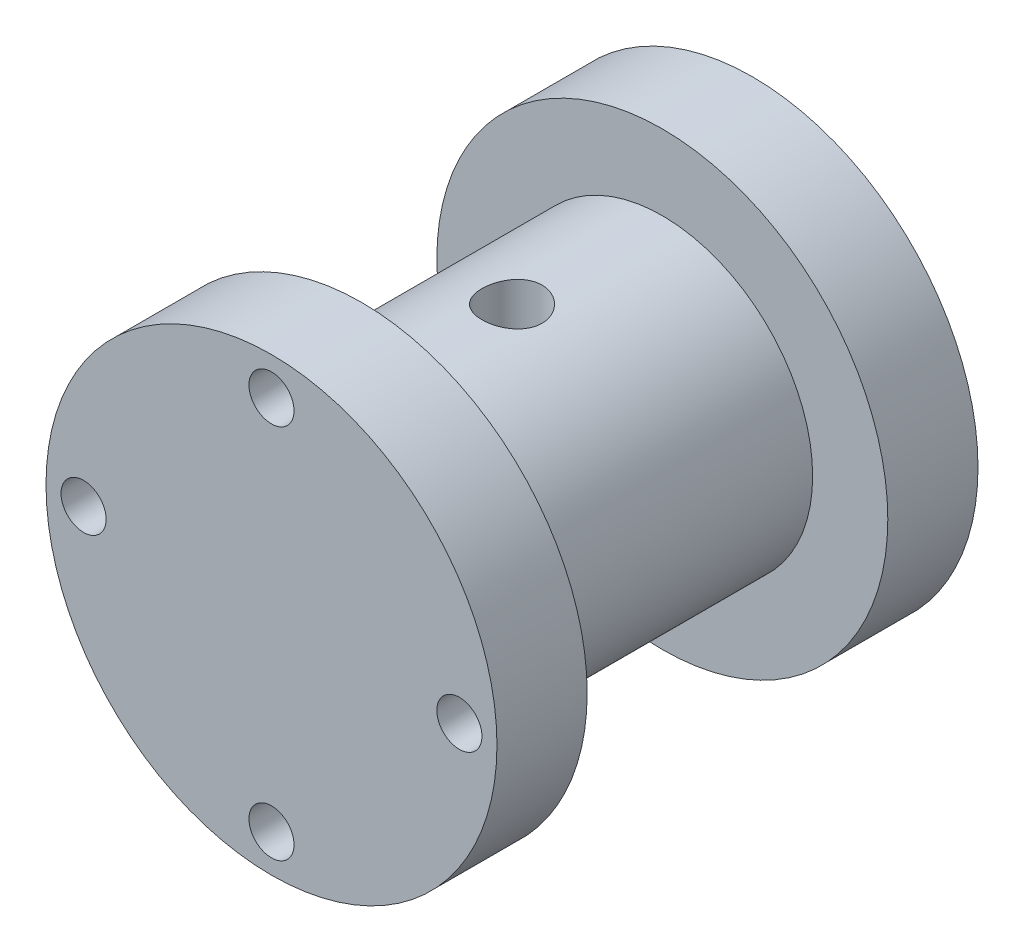
from build123d import *

# Parameters (mm, degrees)
BOSS_EXTRUDE1_DEPTH      = 5
BOSS_EXTRUDE1_DEPTH_BACK = 5
SKETCH1_R                = 5
SKETCH3_R                = 7.5
BOSS_EXTRUDE2_DEPTH      = 3
SKETCH4_R                = 1
CUT_EXTRUDE1_DEPTH       = 17.628289148
SKETCH5_R                = 0.75
CUT_EXTRUDE2_DEPTH       = 17.777961736
CIRPATTERN1_COUNT        = 4


with BuildPart() as part:
    # Sketch1 → Boss-Extrude1 (new, two sides: drawn at the far end of the back side and taken through both)
    with BuildSketch(Plane.XY.offset(-BOSS_EXTRUDE1_DEPTH_BACK)):
        Circle(SKETCH1_R)
    extrude(amount=BOSS_EXTRUDE1_DEPTH + BOSS_EXTRUDE1_DEPTH_BACK)

    # Sketch3 → Boss-Extrude2 (add)
    with BuildSketch(Plane.XY.offset(5)):
        Circle(SKETCH3_R)
    boss_extrude2 = extrude(amount=BOSS_EXTRUDE2_DEPTH)

    # Mirror1: Boss-Extrude2 across plane
    add(boss_extrude2.mirror(Plane.XY))

    # Sketch4 → Cut-Extrude1 (cut, through all)
    with BuildSketch(Plane(origin=(0, 5, 0), x_dir=(1, 0, 0), z_dir=(0, 1, 0))):
        Circle(SKETCH4_R)
    extrude(amount=-CUT_EXTRUDE1_DEPTH, mode=Mode.SUBTRACT)

    # Sketch5 → Cut-Extrude2 (cut, through all)
    with BuildSketch(Plane(origin=(0, 0, 5), x_dir=(-1, 0, 0), z_dir=(0, 0, -1))):
        with Locations((0, 6.25)):
            Circle(SKETCH5_R)
    cut_extrude2 = extrude(amount=-CUT_EXTRUDE2_DEPTH, mode=Mode.SUBTRACT)

    # CirPattern1: Cut-Extrude2 ×4 about axis
    cirpattern1_axis = Axis((0, 0, -5), (0, 0, 1))
    for i in range(1, CIRPATTERN1_COUNT):
        add(cut_extrude2.rotate(cirpattern1_axis, i * 360 / CIRPATTERN1_COUNT), mode=Mode.SUBTRACT)


solid = part.part
